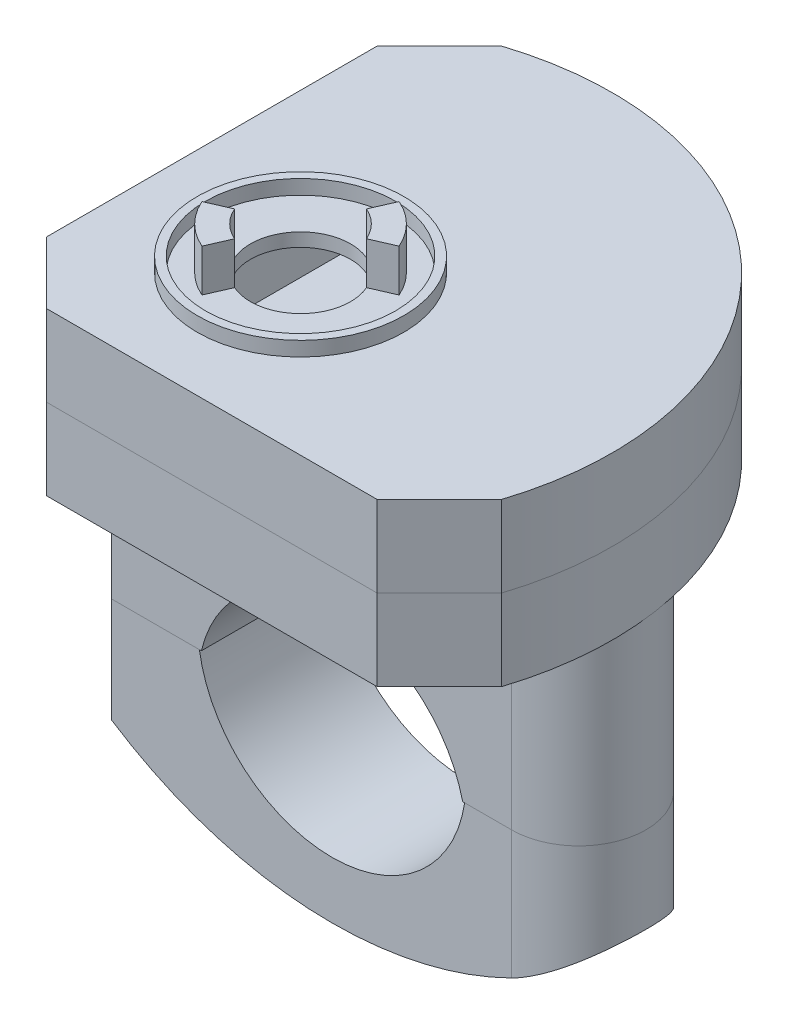
from build123d import *

# Parameters (mm, degrees)
RESSALTO_EXTRUS_O1_DEPTH = 7.85
ESBO_O3_R                = 10
RESSALTO_EXTRUS_O2_DEPTH = 1.4
CASCA1_T                 = -1.3
CASCA2_T                 = -1.3
ESBO_O4_R                = 4.85
CORTE_EXTRUS_O1_DEPTH    = 67.580102133
ESBO_O5_R                = 9.2
CORTE_EXTRUS_O2_DEPTH    = 1.4
RESSALTO_EXTRUS_O5_START = -1.3
ESBO_O7_R                = 8.7
ESBO_O7_R_2              = 4.85
RESSALTO_EXTRUS_O5_DEPTH = 1.3
RESSALTO_EXTRUS_O3_DEPTH = 4.1
RESSALTO_EXTRUS_O6_DEPTH = 34.3
CORTE_EXTRUS_O4_DEPTH    = 34.3
ESBO_O10_R               = 13.001125
CORTE_EXTRUS_O3_DEPTH    = 20
ESBO_O12_R               = 58.064815878
ESBO_O12_R_2             = 39.076522869
ESBO_O12_R_3             = 13.001125
CORTE_EXTRUS_O5_DEPTH    = 13


# Read off the part's stored shape, not the designer's step: Dividir2
with BuildPart() as part:
    # Esboço1 → Ressalto-extrusão1 (new, symmetric)
    with BuildSketch(Plane(origin=(0, 0, 0), x_dir=(1, 0, 0), z_dir=(0, 1, 0))):
        with BuildLine():
            Line((0, 6.01040764), (6.01040764, 0))
            Line((6.01040764, 0), (38.025344896, 0))
            Line((38.025344896, 0), (44.035752536, 6.01040764))
            ThreePointArc((44.035752536, 6.01040764), (36.654624792, 36.654624792), (6.01040764, 44.035752536))
            Line((6.01040764, 44.035752536), (0, 38.025344896))
            Line((0, 38.025344896), (0, 6.01040764))
        make_face()
    extrude(amount=RESSALTO_EXTRUS_O1_DEPTH, both=True)

    # Esboço3 → Ressalto-extrusão2 (add)
    with BuildSketch(Plane(origin=(0, 7.85, 0), x_dir=(1, 0, 0), z_dir=(0, 1, 0))):
        with Locations(Location((15.3, 15.3, 0), (0, 0, 270))):
            Circle(ESBO_O3_R)
    extrude(amount=RESSALTO_EXTRUS_O2_DEPTH)


with BuildPart() as body_2:
    # Dividir1: the piece on the far side of the plane
    add(part.part)
    split(bisect_by=Plane.ZX, keep=Keep.BOTTOM)

    # Casca1
    casca1_openings = [body_2.faces().sort_by_distance(p)[0] for p in [
        (21.196466448, 0, -21.196466448),
    ]]
    offset(amount=CASCA1_T, openings=casca1_openings, kind=Kind.INTERSECTION)

    # Esboço8 → Ressalto-extrusão6 (add)
    with BuildSketch(Plane.XZ.offset(7.85)):
        with BuildLine():
            Line((0, -12.3), (45.350623954, -12.3))
            ThreePointArc((45.350623954, -12.3), (45.286430787, -18.885243179), (43.796315551, -25.3))
            Line((43.796315551, -25.3), (0, -25.3))
            Line((0, -25.3), (0, -12.3))
        make_face()
    extrude(amount=RESSALTO_EXTRUS_O6_DEPTH)

    # Esboço11 → Corte-extrusão4 (cut)
    with BuildSketch(Plane.XZ.offset(42.15)):
        with BuildLine():
            Line((38.740136518, -12.3), (51.009297324, -12.3))
            Line((51.009297324, -12.3), (51.009297324, -25.3))
            Line((51.009297324, -25.3), (38.740136518, -25.3))
            ThreePointArc((38.740136518, -25.3), (45.240136518, -18.8), (38.740136518, -12.3))
        make_face()
    extrude(amount=-CORTE_EXTRUS_O4_DEPTH, mode=Mode.SUBTRACT)


with BuildPart() as part_1:
    add(part.part)

    # Dividir1
    split(bisect_by=Plane.ZX, keep=Keep.TOP)

    # Casca2
    casca2_openings = [part_1.faces().sort_by_distance(p)[0] for p in [
        (21.196466448, 0, -21.196466448),
    ]]
    offset(amount=CASCA2_T, openings=casca2_openings, kind=Kind.INTERSECTION)

    # Esboço4 → Corte-extrusão1 (cut, through all)
    with BuildSketch(Plane(origin=(0, 9.25, 0), x_dir=(1, 0, 0), z_dir=(0, 1, 0))):
        with Locations(Location((15.3, 15.3, 0), (0, 0, 270))):
            Circle(ESBO_O4_R)
    extrude(amount=-CORTE_EXTRUS_O1_DEPTH, mode=Mode.SUBTRACT)

    # Esboço5 → Corte-extrusão2 (cut)
    with BuildSketch(Plane(origin=(0, 9.25, 0), x_dir=(1, 0, 0), z_dir=(0, 1, 0))):
        with Locations(Location((15.3, 15.3, 0), (0, 0, 270))):
            Circle(ESBO_O5_R)
    extrude(amount=-CORTE_EXTRUS_O2_DEPTH, mode=Mode.SUBTRACT)

    # Esboço7 → Ressalto-extrusão5 (add)
    with BuildSketch(Plane(origin=(0, 7.85, 0), x_dir=(1, 0, 0), z_dir=(0, 1, 0)).offset(RESSALTO_EXTRUS_O5_START)):
        with Locations((15.3, 15.3)):
            Circle(ESBO_O7_R)
        with Locations(Location((15.3, 15.3, 0), (0, 0, 270))):
            Circle(ESBO_O7_R_2, mode=Mode.SUBTRACT)
    extrude(amount=RESSALTO_EXTRUS_O5_DEPTH)

    # Esboço6 → Ressalto-extrusão3 (add)
    with BuildSketch(Plane(origin=(0, 7.85, 0), x_dir=(1, 0, 0), z_dir=(0, 1, 0))):
        with BuildLine():
            Line((10.856152793, 13.357135619), (8.657135619, 12.395718193))
            ThreePointArc((8.657135619, 12.395718193), (10.173475836, 10.173475836), (12.395718193, 8.657135619))
            Line((12.395718193, 8.657135619), (13.357135619, 10.856152793))
            ThreePointArc((13.357135619, 10.856152793), (11.870532111, 11.870532111), (10.856152793, 13.357135619))
        make_face()
        with BuildLine():
            Line((17.242864381, 19.743847207), (18.204281807, 21.942864381))
            ThreePointArc((18.204281807, 21.942864381), (20.426524164, 20.426524164), (21.942864381, 18.204281807))
            Line((21.942864381, 18.204281807), (19.743847207, 17.242864381))
            ThreePointArc((19.743847207, 17.242864381), (18.729467889, 18.729467889), (17.242864381, 19.743847207))
        make_face()
    extrude(amount=RESSALTO_EXTRUS_O3_DEPTH)


with BuildPart() as body_3:
    # Dividir2: the piece on the far side of the plane
    add(body_2.part)
    split(bisect_by=Plane(origin=(0, -25.65, 0), x_dir=(1, 0, 0), z_dir=(0, 1, 0)), keep=Keep.BOTTOM)

    # Esboço12 → Corte-extrusão5 (cut)
    # profile 1 of 2: a face of its own
    with BuildSketch(Plane(origin=(0, 0, -25.3), x_dir=(-1, 0, 0), z_dir=(0, 0, -1))):
        with Locations((-21.35, -3.073477131)):
            Circle(ESBO_O12_R)
        with Locations((-21.35, -3.073477131)):
            Circle(ESBO_O12_R_2, mode=Mode.SUBTRACT)
    # profile 2 of 2: a face of its own
    with BuildSketch(Plane(origin=(0, 0, -25.3), x_dir=(-1, 0, 0), z_dir=(0, 0, -1))):
        with Locations((-21.35, -23.648875)):
            Circle(ESBO_O12_R_3)
    extrude(amount=-CORTE_EXTRUS_O5_DEPTH, mode=Mode.SUBTRACT)


with BuildPart() as body_2_1:
    add(body_2.part)

    # Dividir2
    split(bisect_by=Plane(origin=(0, -25.65, 0), x_dir=(1, 0, 0), z_dir=(0, 1, 0)), keep=Keep.TOP)

    # Esboço10 → Corte-extrusão3 (cut)
    with BuildSketch(Plane(origin=(0, 0, -25.3), x_dir=(-1, 0, 0), z_dir=(0, 0, -1))):
        with Locations((-21.35, -28.651125)):
            Circle(ESBO_O10_R)
    extrude(amount=-CORTE_EXTRUS_O3_DEPTH, mode=Mode.SUBTRACT)


solid = Compound([part_1.part, body_3.part, body_2_1.part])
